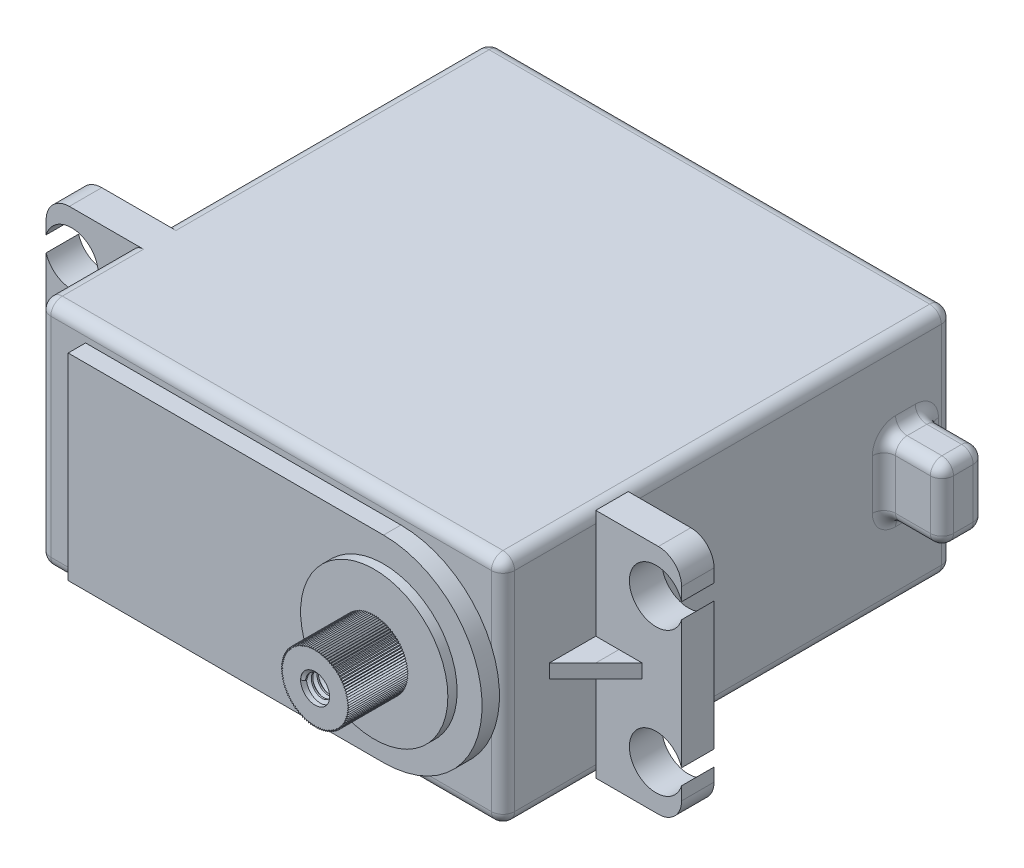
from build123d import *
from build123d.topology import SkipClean

# Parameters (mm, degrees)
SKETCH1_W            = 40
SKETCH1_H            = 20
BOSS_EXTRUDE1_DEPTH  = 38.8
SKETCH2_W            = 2.8
SKETCH2_H            = 20
BOSS_EXTRUDE2_DEPTH  = 7.4
SKETCH3_R            = 2.3
CUT_EXTRUDE1_DEPTH   = 43.419335
FILLET1_R            = 2
RIB5_OUTLINE_W       = 4
RIB5_OUTLINE_H       = 1.2
RIB5_DEPTH           = 4
CUT_EXTRUDE2_DEPTH   = 49.667854
SKETCH6_W            = 3.7
SKETCH6_H            = 6.3
BOSS_EXTRUDE3_DEPTH  = 5
FILLET3_R            = 1
BOSS_EXTRUDE4_DEPTH  = 1.5
SKETCH8_R            = 6.35
BOSS_EXTRUDE5_DEPTH  = 0.8
BOSS_EXTRUDE6_DEPTH  = 5.1
SKETCH10_R           = 1.25
CUT_EXTRUDE3_DEPTH   = 6
THREAD1_PITCH        = 0.5
FILLET1_OF_MIRROR1_R = 2


# Read off the part's stored shape, not the designer's step: Rib5
with BuildPart() as part:
    # Sketch1 → Boss-Extrude1 (new body)
    with BuildSketch(Plane.XY):
        Rectangle(SKETCH1_W, SKETCH1_H)
    extrude(amount=BOSS_EXTRUDE1_DEPTH)

    # Sketch2 → Boss-Extrude2 (add)
    with BuildSketch(Plane.ZY.offset(20)):
        with Locations((29.4, 0)):
            Rectangle(SKETCH2_W, SKETCH2_H)
    boss_extrude2 = extrude(amount=BOSS_EXTRUDE2_DEPTH)

    # Sketch3 → Cut-Extrude1 (cut, through all)
    with BuildSketch(Plane.XY.offset(30.8)):
        with Locations((-25.2, 6.2)):
            Circle(SKETCH3_R)
        with Locations((-25.2, -6.2)):
            Circle(SKETCH3_R)
    cut_extrude1 = extrude(amount=-CUT_EXTRUDE1_DEPTH, mode=Mode.SUBTRACT)

    # Fillet1
    fillet1_edges = [part.edges().sort_by_distance(p)[0] for p in [
        (-27.4, -10, 29.4),
        (-27.4, 10, 29.4),
    ]]
    fillet(fillet1_edges, radius=FILLET1_R)

    # Rib5 outline → Rib5 (add)
    with BuildSketch(Plane.XY.offset(30.8)):
        with Locations((-22, 0)):
            Rectangle(RIB5_OUTLINE_W, RIB5_OUTLINE_H)
    rib5 = extrude(amount=RIB5_DEPTH)

    # Sketch5 → Cut-Extrude2 (cut, through all)
    with BuildSketch(Plane.XZ.offset(0.6)):
        Polygon((-24, 34.8), (-24, 30.8), (-20, 34.8), align=None)
    cut_extrude2 = extrude(amount=-CUT_EXTRUDE2_DEPTH, mode=Mode.SUBTRACT)

    # Sketch6 → Boss-Extrude3 (add)
    with BuildSketch(Plane.ZY.offset(-20)):
        with Locations((4.098205, 0)):
            Rectangle(SKETCH6_W, SKETCH6_H)
    extrude(amount=-BOSS_EXTRUDE3_DEPTH)

    # Fillet3
    fillet3_edges = [part.edges().sort_by_distance(p)[0] for p in [
        (25, 0, 5.948205),
        (22.5, 3.15, 5.948205),
        (25, -3.15, 4.098205),
        (22.5, -3.15, 5.948205),
        (25, 0, 2.248205),
        (22.5, -3.15, 2.248205),
        (25, 3.15, 4.098205),
        (22.5, 3.15, 2.248205),
        (20, 0, 5.948205),
        (20, 3.15, 4.098205),
        (20, 0, 2.248205),
        (20, -3.15, 4.098205),
        (-20, 0, 38.8),
        (-20, -10, 14),
        (-20, 10, 14),
        (0, -10, 38.8),
        (20, 0, 38.8),
        (0, -10, 0),
        (-20, 0, 0),
        (0, 10, 0),
        (20, 0, 0),
        (20, -10, 19.4),
        (-20, -10, 34.8),
        (-20, 10, 34.8),
        (20, 10, 19.4),
        (0, 10, 38.8),
    ]]
    fillet(fillet3_edges, radius=FILLET3_R)

    # Sketch7 → Boss-Extrude4 (add)
    with BuildSketch(Plane.XY.offset(38.8)):
        with BuildLine():
            Line((-16, 8.5), (11.194571, 8.5))
            ThreePointArc((11.194571, 8.5), (19.694571, 0), (11.194571, -8.5))
            Line((11.194571, -8.5), (-16, -8.5))
            Line((-16, -8.5), (-16, 8.5))
        make_face()
    extrude(amount=BOSS_EXTRUDE4_DEPTH)

    # Sketch8 → Boss-Extrude5 (add)
    with BuildSketch(Plane.XY.offset(40.3)):
        with Locations((11.194571, 0)):
            Circle(SKETCH8_R)
    extrude(amount=BOSS_EXTRUDE5_DEPTH)

    # Sketch9 → Boss-Extrude6 (add)
    with BuildSketch(Plane.XY.offset(41.1)):
        Polygon((11.194571, 2.941835), (11.107151, 2.798635), (11.010911, 2.936063), (10.932655, 2.787657), (10.827976, 2.918771), (10.759192, 2.765743), (10.646487, 2.890026), (10.587448, 2.732981), (10.467162, 2.849942), (10.4181, 2.6895), (10.290707, 2.798677), (10.251816, 2.635471), (10.117819, 2.736434), (10.089253, 2.571108), (9.949181, 2.663457), (9.931052, 2.496664), (9.785458, 2.580036), (9.777838, 2.412434), (9.627296, 2.486499), (9.630215, 2.318749), (9.475319, 2.383216), (9.488766, 2.215981), (9.330128, 2.270594), (9.354048, 2.104533), (9.192294, 2.149078), (9.226595, 1.984846), (9.062363, 2.019146), (9.106908, 1.857392), (8.940846, 1.881313), (8.99546, 1.722675), (8.828224, 1.736121), (8.892691, 1.581226), (8.724941, 1.584144), (8.799006, 1.433602), (8.631404, 1.425982), (8.714776, 1.280388), (8.547983, 1.262259), (8.640332, 1.122187), (8.475007, 1.093621), (8.575969, 0.959624), (8.412763, 0.920733), (8.52194, 0.79334), (8.361499, 0.744279), (8.478459, 0.623992), (8.321415, 0.564953), (8.445697, 0.452248), (8.29267, 0.383465), (8.423784, 0.278786), (8.275377, 0.20053), (8.412805, 0.10429), (8.269605, 0.016869), (8.412805, -0.070551), (8.275377, -0.166791), (8.423784, -0.245047), (8.29267, -0.349726), (8.445697, -0.418509), (8.321415, -0.531214), (8.478459, -0.590254), (8.361499, -0.71054), (8.52194, -0.759602), (8.412763, -0.886995), (8.575969, -0.925885), (8.475007, -1.059882), (8.640332, -1.088448), (8.547983, -1.22852), (8.714776, -1.246649), (8.631404, -1.392243), (8.799006, -1.399864), (8.724941, -1.550406), (8.892691, -1.547487), (8.828224, -1.702382), (8.99546, -1.688936), (8.940846, -1.847574), (9.106908, -1.823653), (9.062363, -1.985407), (9.226595, -1.951107), (9.192294, -2.115339), (9.354048, -2.070794), (9.330128, -2.236855), (9.488766, -2.182242), (9.475319, -2.349477), (9.630215, -2.285011), (9.627296, -2.452761), (9.777838, -2.378695), (9.785458, -2.546297), (9.931052, -2.462925), (9.949181, -2.629719), (10.089253, -2.537369), (10.117819, -2.702695), (10.251816, -2.601732), (10.290707, -2.764938), (10.4181, -2.655761), (10.467162, -2.816203), (10.587448, -2.699242), (10.646487, -2.856287), (10.759192, -2.732004), (10.827976, -2.885032), (10.932655, -2.753918), (11.010911, -2.902324), (11.107151, -2.764896), (11.194571, -2.908096), (11.281992, -2.764896), (11.378231, -2.902324), (11.456488, -2.753918), (11.561166, -2.885032), (11.62995, -2.732004), (11.742655, -2.856287), (11.801694, -2.699242), (11.92198, -2.816203), (11.971042, -2.655761), (12.098435, -2.764938), (12.137326, -2.601732), (12.271323, -2.702695), (12.299889, -2.537369), (12.439961, -2.629719), (12.45809, -2.462925), (12.603684, -2.546297), (12.611304, -2.378695), (12.761846, -2.452761), (12.758927, -2.285011), (12.913823, -2.349477), (12.900376, -2.182242), (13.059014, -2.236855), (13.035094, -2.070794), (13.196848, -2.115339), (13.162547, -1.951107), (13.326779, -1.985407), (13.282234, -1.823653), (13.448296, -1.847574), (13.393682, -1.688936), (13.560918, -1.702382), (13.496451, -1.547487), (13.664201, -1.550406), (13.590136, -1.399864), (13.757738, -1.392243), (13.674366, -1.246649), (13.841159, -1.22852), (13.74881, -1.088448), (13.914135, -1.059882), (13.813173, -0.925885), (13.976379, -0.886995), (13.867202, -0.759602), (14.027643, -0.71054), (13.910683, -0.590254), (14.067727, -0.531214), (13.943445, -0.418509), (14.096472, -0.349726), (13.965358, -0.245047), (14.113765, -0.166791), (13.976337, -0.070551), (14.119537, 0.016869), (13.976337, 0.10429), (14.113765, 0.20053), (13.965358, 0.278786), (14.096472, 0.383465), (13.943445, 0.452248), (14.067727, 0.564953), (13.910683, 0.623992), (14.027643, 0.744279), (13.867202, 0.79334), (13.976379, 0.920733), (13.813173, 0.959624), (13.914135, 1.093621), (13.74881, 1.122187), (13.841159, 1.262259), (13.674366, 1.280388), (13.757738, 1.425982), (13.590136, 1.433602), (13.664201, 1.584144), (13.496451, 1.581226), (13.560918, 1.736121), (13.393682, 1.722675), (13.448296, 1.881313), (13.282234, 1.857392), (13.326779, 2.019146), (13.162547, 1.984846), (13.196848, 2.149078), (13.035094, 2.104533), (13.059014, 2.270594), (12.900376, 2.215981), (12.913823, 2.383216), (12.758927, 2.318749), (12.761846, 2.486499), (12.611304, 2.412434), (12.603684, 2.580036), (12.45809, 2.496664), (12.439961, 2.663457), (12.299889, 2.571108), (12.271323, 2.736434), (12.137326, 2.635471), (12.098435, 2.798677), (11.971042, 2.6895), (11.92198, 2.849942), (11.801694, 2.732981), (11.742655, 2.890026), (11.62995, 2.765743), (11.561166, 2.918771), (11.456488, 2.787657), (11.378231, 2.936063), (11.281992, 2.798635), align=None)
    extrude(amount=BOSS_EXTRUDE6_DEPTH)

    # Sketch10 → Cut-Extrude3 (cut)
    with BuildSketch(Plane.XY.offset(46.2)):
        with Locations((11.194571, 0)):
            Circle(SKETCH10_R)
    extrude(amount=-CUT_EXTRUDE3_DEPTH, mode=Mode.SUBTRACT)

    # Thread1: the profile of Thread Profile1 profile screwed along a right-hand helix of 12 turns, 6 arcs to a turn; built about Z, then put on its axis
    with SkipClean():  # the faces are left unmerged after this step: merging them gives an invalid solid
        thread1_z = Axis((0, 0, 0), (0, 0, 1))
        thread1_corners = [(1.2503, 0, -0.000173), (1.2503, 0, 0.437673), (0.979367, 0, 0.28125), (0.979367, 0, 0.15625)]
        with BuildLine(mode=Mode.PRIVATE) as thread1_profile:
            Line(thread1_corners[0], thread1_corners[1])
            Line(thread1_corners[1], thread1_corners[2])
            Line(thread1_corners[2], thread1_corners[3])
            Line(thread1_corners[3], thread1_corners[0])
        thread1_cap = Face(thread1_profile.wire())
        thread1_turn_angles = [0, 30, 60, 90, 120, 150, 180, 210, 240, 270, 300, 330, 360]
        thread1_turn_weights = [1, 0.8660254037844387, 1, 0.8660254037844387, 1, 0.8660254037844387, 1, 0.8660254037844387, 1, 0.8660254037844387, 1, 0.8660254037844387, 1]
        thread1_turn_rails = [Edge.make_bspline([Vector(p[0], p[1], 0).rotate(thread1_z, thread1_turn_angles[k]) / thread1_turn_weights[k] + Vector(0, 0, p[2] + THREAD1_PITCH * thread1_turn_angles[k] / 360) for k in range(13)], [0, 0, 0, 1, 1, 2, 2, 3, 3, 4, 4, 5, 5, 6, 6, 6], 2, thread1_turn_weights) for p in thread1_corners]
        thread1_turn_sides = [Face.make_surface_from_curves(thread1_turn_rails[p[0]], thread1_turn_rails[p[1]]) for p in [(0, 1), (1, 2), (2, 3), (3, 0)]]
        thread1 = Plane(origin=(11.194571, 0, 46.2), x_dir=(-1, 0, 0), z_dir=(0, 0, -1)) * Solid(Shell([*[p.moved(Location((0, 0, THREAD1_PITCH * i))) for i in range(12) for p in thread1_turn_sides], thread1_cap, thread1_cap.rotate(thread1_z, 4320).moved(Location((0, 0, THREAD1_PITCH * 4320 / 360)))]))
        add(thread1)

    # Mirror1: Boss-Extrude2, Cut-Extrude1, Rib5, Cut-Extrude2 across plane
    with SkipClean():  # the faces are left unmerged after this step: merging them gives an invalid solid
        add(boss_extrude2.mirror(Plane(origin=(0, 0, 0), x_dir=(0, 0, 1), z_dir=(1, 0, 0))))
        add(cut_extrude1.mirror(Plane(origin=(0, 0, 0), x_dir=(0, 0, 1), z_dir=(1, 0, 0))), mode=Mode.SUBTRACT)
        add(rib5.mirror(Plane(origin=(0, 0, 0), x_dir=(0, 0, 1), z_dir=(1, 0, 0))))
        add(cut_extrude2.mirror(Plane(origin=(0, 0, 0), x_dir=(0, 0, 1), z_dir=(1, 0, 0))), mode=Mode.SUBTRACT)

    # Fillet1 of Mirror1
    fillet1_of_mirror1_edges = [part.edges().sort_by_distance(p)[0] for p in [
        (27.4, -10, 29.4),
        (27.4, 10, 29.4),
    ]]
    fillet(fillet1_of_mirror1_edges, radius=FILLET1_OF_MIRROR1_R)


solid = part.part
